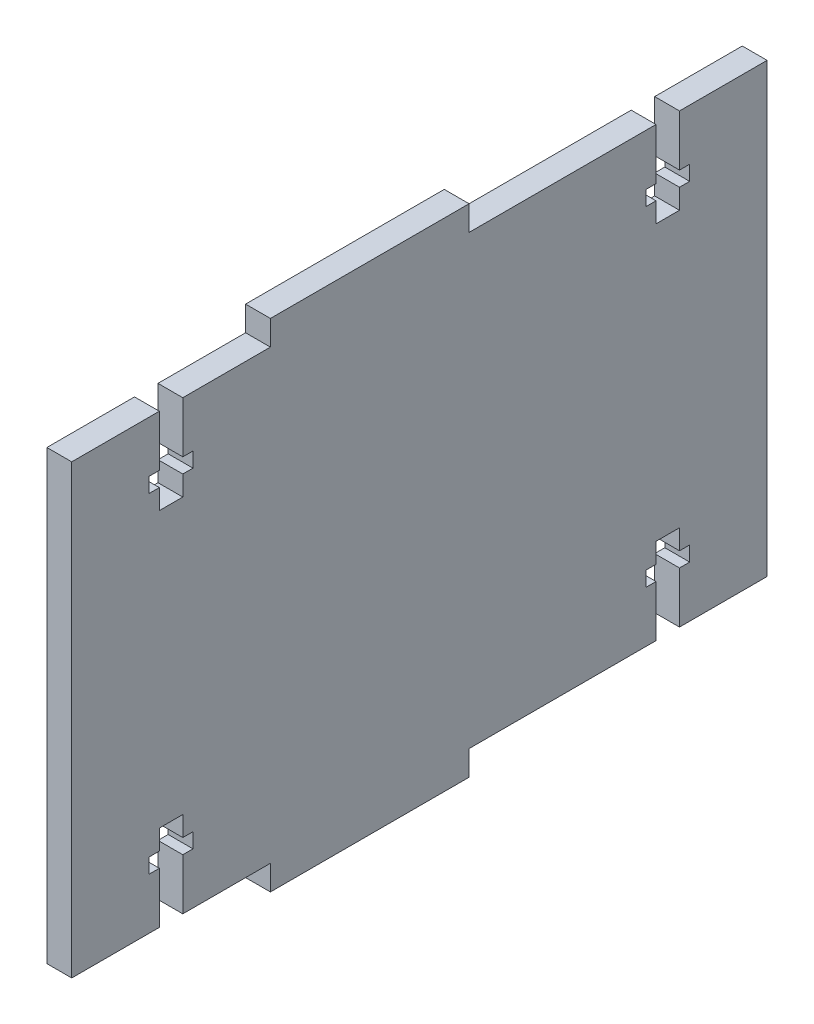
from build123d import *

# Parameters (mm, degrees)
SKETCH1_W           = 88.9
SKETCH1_H           = 63.5
BOSS_EXTRUDE1_DEPTH = 3.175
SKETCH2_W           = 38.1
SKETCH2_H           = 3.175
CUT_EXTRUDE1_DEPTH  = 55.716959208
CUT_EXTRUDE2_DEPTH  = 55.716959208


with BuildPart() as part:
    # Sketch1 → Boss-Extrude1 (new body)
    with BuildSketch(Plane(origin=(0, 0, 0), x_dir=(0, 0, -1), z_dir=(1, 0, 0))):
        Rectangle(SKETCH1_W, SKETCH1_H)
    extrude(amount=BOSS_EXTRUDE1_DEPTH)

    # Sketch2 → Cut-Extrude1 (cut, through all)
    with BuildSketch(Plane(origin=(3.175, 0, 0), x_dir=(0, 0, -1), z_dir=(1, 0, 0))):
        with Locations((25.4, -30.1625)):
            Rectangle(SKETCH2_W, SKETCH2_H)
        Polygon((-19.05, 28.575), (-44.45, 28.575), (-44.45, 31.75), (-41.275, 31.75), (-19.05, 31.75), align=None)
        Polygon((-44.45, -31.75), (-41.275, -31.75), (-19.05, -31.75), (-19.05, -28.575), (-44.45, -28.575), align=None)
        with Locations((25.4, 30.1625)):
            Rectangle(SKETCH2_W, SKETCH2_H)
    extrude(amount=-CUT_EXTRUDE1_DEPTH, mode=Mode.SUBTRACT)

    # Sketch3 → Cut-Extrude2 (cut, through all)
    with BuildSketch(Plane(origin=(3.175, 0, 0), x_dir=(0, 0, -1), z_dir=(1, 0, 0))):
        Polygon((-30.25, -17.575), (-30.25, -20.125), (-28.95, -20.125), (-28.95, -22.025), (-30.25, -22.025), (-30.25, -28.575), (-33.25, -28.575), (-33.25, -22.025), (-34.55, -22.025), (-34.55, -20.125), (-33.25, -20.125), (-33.25, -17.575), align=None)
        Polygon((33.25, -17.575), (33.25, -20.125), (34.55, -20.125), (34.55, -22.025), (33.25, -22.025), (33.25, -28.575), (30.25, -28.575), (30.25, -22.025), (28.95, -22.025), (28.95, -20.125), (30.25, -20.125), (30.25, -17.575), align=None)
        Polygon((33.25, 20.125), (34.55, 20.125), (34.55, 22.025), (33.25, 22.025), (33.25, 28.575), (30.25, 28.575), (30.25, 22.025), (28.95, 22.025), (28.95, 20.125), (30.25, 20.125), (30.25, 17.575), (33.25, 17.575), align=None)
        Polygon((-30.25, 20.125), (-28.95, 20.125), (-28.95, 22.025), (-30.25, 22.025), (-30.25, 28.575), (-33.25, 28.575), (-33.25, 22.025), (-34.55, 22.025), (-34.55, 20.125), (-33.25, 20.125), (-33.25, 17.575), (-30.25, 17.575), align=None)
    extrude(amount=-CUT_EXTRUDE2_DEPTH, mode=Mode.SUBTRACT)


solid = part.part
